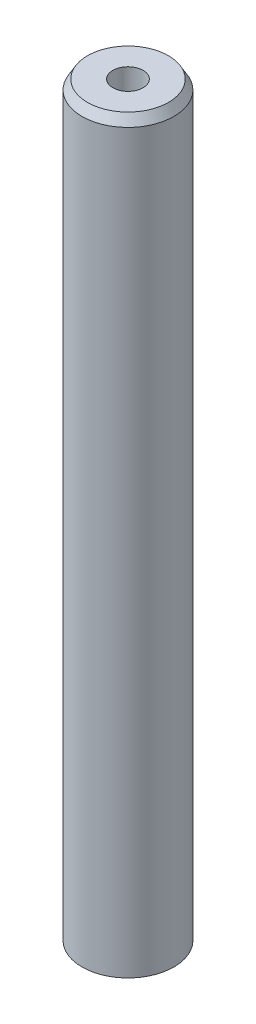
from build123d import *
from OCP.BRepFilletAPI import BRepFilletAPI_MakeChamfer

# Parameters (mm, degrees)
SKETCH1_R           = 22.5
BOSS_EXTRUDE1_DEPTH = 368.093118582
SKETCH2_R           = 7.403386057
CUT_EXTRUDE1_DEPTH  = 370.4658901
CHAMFER1_SIZE       = 4.621524843
CHAMFER1_SIZE2      = 2.668238612


with BuildPart() as part:
    # Sketch1 → Boss-Extrude1 (new body)
    with BuildSketch(Plane(origin=(0, 0, 0), x_dir=(1, 0, 0), z_dir=(0, 1, 0))):
        Circle(SKETCH1_R)
    extrude(amount=BOSS_EXTRUDE1_DEPTH)

    # Sketch2 → Cut-Extrude1 (cut, through all)
    with BuildSketch(Plane(origin=(0, 0, 0), x_dir=(1, 0, 0), z_dir=(0, 1, 0))):
        Circle(SKETCH2_R)
    extrude(amount=CUT_EXTRUDE1_DEPTH, mode=Mode.SUBTRACT)

    # Chamfer1: one chamfer whose edges measure the first distance from different faces: ONE call of the kernel's chamfer builder (chamfer() names one face for all edges)
    chamfer1_edges_1 = [part.edges().sort_by_distance(p)[0] for p in [
        (-22.5, 368.093118582, 0),
    ]]
    chamfer1_side_1 = [part.faces().sort_by_distance(p)[0] for p in [
        (-22.5, 184.046559291, 0),
    ]]
    chamfer1_edges_2 = [part.edges().sort_by_distance(p)[0] for p in [
        (-22.5, 0, 0),
    ]]
    chamfer1_side_2 = [part.faces().sort_by_distance(p)[0] for p in [
        (-21.863603897, 0, 0),
    ]]
    chamfer1 = BRepFilletAPI_MakeChamfer(part.part.solid().wrapped)
    for e in chamfer1_edges_1:
        chamfer1.Add(CHAMFER1_SIZE, CHAMFER1_SIZE2, e.wrapped, chamfer1_side_1[0].wrapped)  # the first distance lies on this face
    for e in chamfer1_edges_2:
        chamfer1.Add(CHAMFER1_SIZE, CHAMFER1_SIZE2, e.wrapped, chamfer1_side_2[0].wrapped)  # the first distance lies on this face
    add(Compound.cast(chamfer1.Shape()), mode=Mode.REPLACE)


solid = part.part
